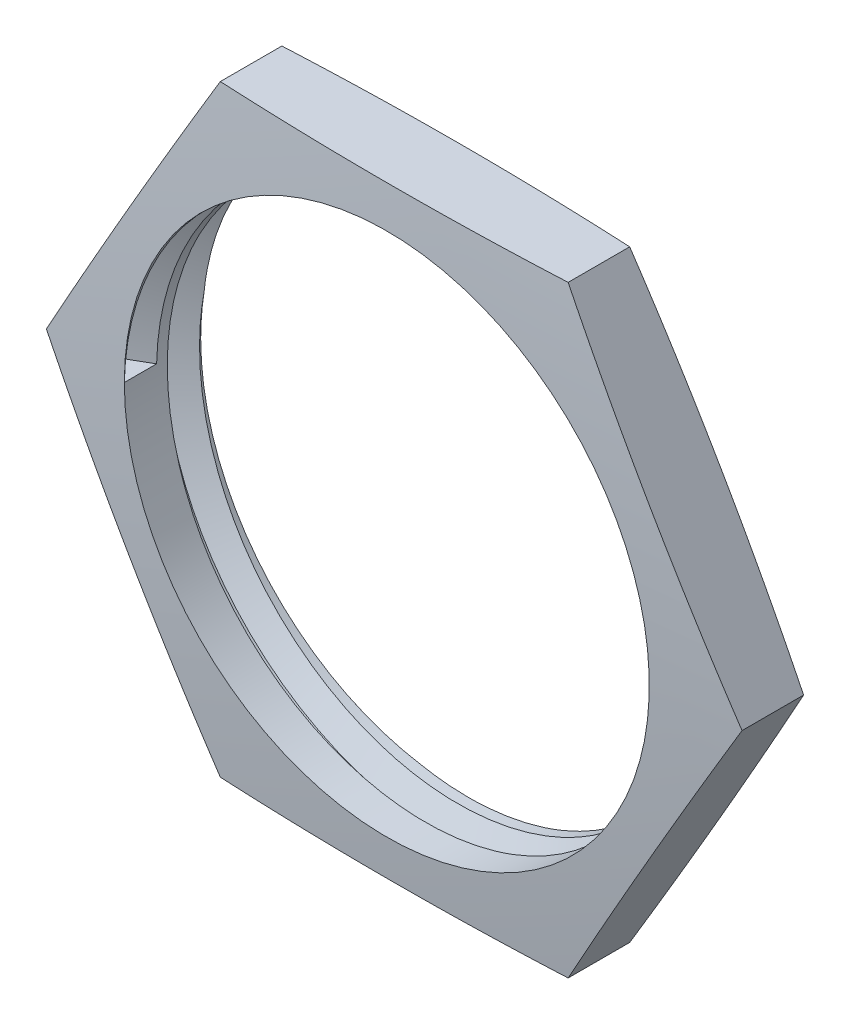
from build123d import *

# Parameters (mm, degrees)
SKETCH1_R           = 6.1
BOSS_EXTRUDE1_DEPTH = 2.23
THREAD1_PITCH       = 1


with BuildPart() as part:
    # Sketch1 → Boss-Extrude1 (new body)
    with BuildSketch(Plane.XY):
        Polygon((8.082903769, 0), (4.041451884, 7), (-4.041451884, 7), (-8.082903769, 0), (-4.041451884, -7), (4.041451884, -7), align=None)
        Circle(SKETCH1_R, mode=Mode.SUBTRACT)
    extrude(amount=BOSS_EXTRUDE1_DEPTH)

    # Sketch3 → Cut-Revolve1 (revolve, cut)
    with BuildSketch(Plane(origin=(0, 0, 0), x_dir=(1, 0, 0), z_dir=(0, 1, 0))):
        with BuildLine():
            Line((0, 1.537986495), (0, 0))
            ThreePointArc((0, 0), (-4.046397575, -0.10006115), (-8.082903769, -0.4))
            Line((-8.082903769, -0.4), (-8.082903769, 1.537986495))
            Line((-8.082903769, 1.537986495), (0, 1.537986495))
        make_face()
        with BuildLine():
            Line((0, -2.23), (0, -3.745876834))
            Line((0, -3.745876834), (-8.082903769, -3.745876834))
            Line((-8.082903769, -3.745876834), (-8.082903769, -1.83))
            ThreePointArc((-8.082903769, -1.83), (-4.046397575, -2.12993885), (0, -2.23))
        make_face()
    revolve(axis=Axis((0, 0, 2.23), (0, 0, 1)), mode=Mode.SUBTRACT)

    # Thread1: the profile of Thread Profile1 profile screwed along a right-hand helix of 10 turns, 8 arcs to a turn; built about Z, then put on its axis
    thread1_z = Axis((0, 0, 0), (0, 0, 1))
    thread1_corners = [(6.0997, 0, -0.000173205), (6.641265875, 0, 0.312499999), (6.641265875, 0, 0.437499999), (6.0997, 0, 0.750173203)]
    with BuildLine(mode=Mode.PRIVATE) as thread1_profile:
        Line(thread1_corners[0], thread1_corners[1])
        Line(thread1_corners[1], thread1_corners[2])
        Line(thread1_corners[2], thread1_corners[3])
        Line(thread1_corners[3], thread1_corners[0])
    thread1_cap = Face(thread1_profile.wire())
    thread1_turn_angles = [0, 22.5, 45, 67.5, 90, 112.5, 135, 157.5, 180, 202.5, 225, 247.5, 270, 292.5, 315, 337.5, 360]
    thread1_turn_weights = [1, 0.9238795325112867, 1, 0.9238795325112867, 1, 0.9238795325112867, 1, 0.9238795325112867, 1, 0.9238795325112867, 1, 0.9238795325112867, 1, 0.9238795325112867, 1, 0.9238795325112867, 1]
    thread1_turn_rails = [Edge.make_bspline([Vector(p[0], p[1], 0).rotate(thread1_z, thread1_turn_angles[k]) / thread1_turn_weights[k] + Vector(0, 0, p[2] + THREAD1_PITCH * thread1_turn_angles[k] / 360) for k in range(17)], [0, 0, 0, 1, 1, 2, 2, 3, 3, 4, 4, 5, 5, 6, 6, 7, 7, 8, 8, 8], 2, thread1_turn_weights) for p in thread1_corners]
    thread1_turn_sides = [Face.make_surface_from_curves(thread1_turn_rails[p[0]], thread1_turn_rails[p[1]]) for p in [(0, 1), (1, 2), (2, 3), (3, 0)]]
    thread1 = Plane(origin=(0, 0, 2.002423916), x_dir=(-1, 0, 0), z_dir=(0, 0, -1)) * Solid(Shell([*[p.moved(Location((0, 0, THREAD1_PITCH * i))) for i in range(10) for p in thread1_turn_sides], thread1_cap, thread1_cap.rotate(thread1_z, 3600).moved(Location((0, 0, THREAD1_PITCH * 3600 / 360)))]))
    add(thread1, mode=Mode.SUBTRACT)


solid = part.part
